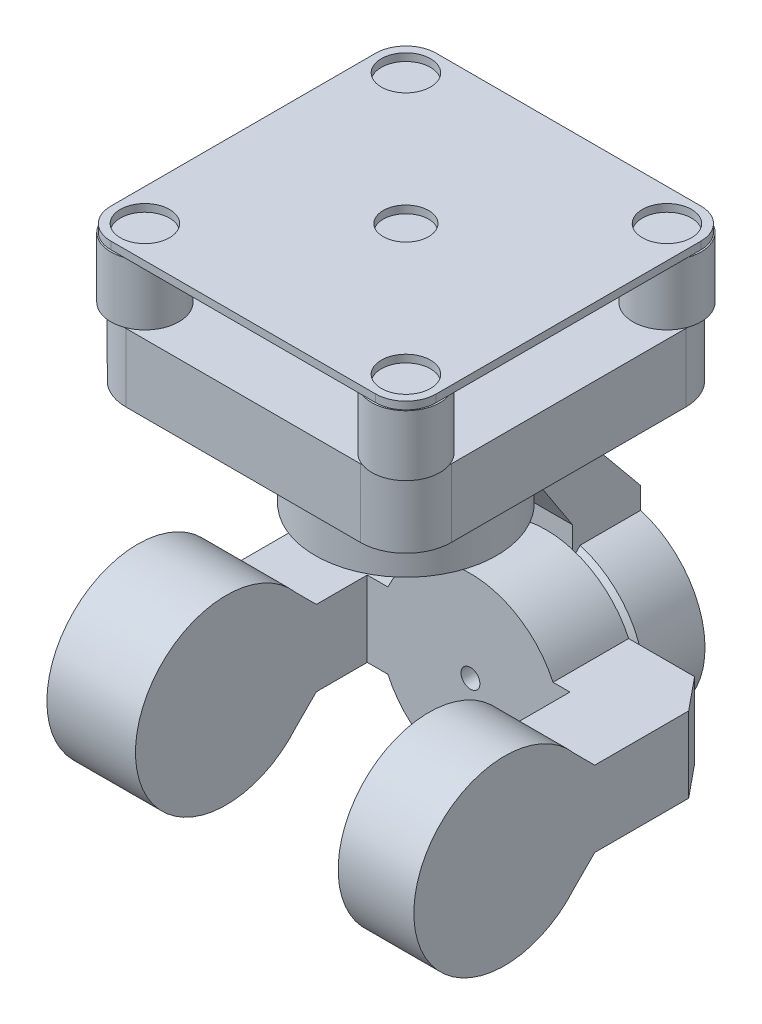
from build123d import *

# Parameters (mm, degrees)
SKETCH1_R               = 3.25
BOSS_EXTRUDE1_DEPTH     = 1
SKETCH3_R               = 4.5
BOSS_EXTRUDE2_DEPTH     = 8
SKETCH4_W               = 43
SKETCH4_H               = 43
BOSS_EXTRUDE3_DEPTH     = 9
FILLET1_R               = 6
SKETCH5_R               = 12
BOSS_EXTRUDE4_DEPTH     = 14
CUT_EXTRUDE1_START      = 7
SKETCH6_R               = 12
SKETCH6_R_2             = 11
CUT_EXTRUDE1_DEPTH      = 1
BOSS_EXTRUDE5_DEPTH     = 3.5
FILLET2_R               = 4
SKETCH8_R               = 12
BOSS_EXTRUDE6_DEPTH     = 9
CHAMFER1_SIZE           = 1
BOSS_EXTRUDE7_START     = 10
SKETCH10_R              = 12
BOSS_EXTRUDE7_DEPTH     = 10
BOSS_EXTRUDE8_DEPTH     = 5
SKETCH12_R              = 12
BOSS_EXTRUDE9_DEPTH     = 48.5
CUT_EXTRUDE2_DEPTH      = 72.827221304
CUT_EXTRUDE2_DEPTH_BACK = 20
SKETCH13_W              = 26.789167307
SKETCH13_H              = 48.357994596
CHAMFER2_SIZE           = 1
CHAMFER4_SIZE           = 1
CHAMFER5_SIZE           = 1
SKETCH17_R              = 1.25
CUT_EXTRUDE4_DEPTH      = 88.387187875
CUT_EXTRUDE5_REACH      = 79.888
SKETCH18_R              = 3
SKETCH19_R              = 1.5
CUT_EXTRUDE6_DEPTH      = 53.140487552


with BuildPart() as part:
    # Sketch1 → Boss-Extrude1 (new body)
    with BuildSketch(Plane(origin=(0, 0, 0), x_dir=(1, 0, 0), z_dir=(0, 1, 0))):
        with BuildLine():
            Line((-17.5, -21.5), (17.5, -21.5))
            ThreePointArc((17.5, -21.5), (20.328427125, -20.328427125), (21.5, -17.5))
            Line((21.5, -17.5), (21.5, 17.5))
            ThreePointArc((21.5, 17.5), (20.328427125, 20.328427125), (17.5, 21.5))
            Line((17.5, 21.5), (-17.5, 21.5))
            ThreePointArc((-17.5, 21.5), (-20.328427125, 20.328427125), (-21.5, 17.5))
            Line((-21.5, 17.5), (-21.5, -17.5))
            ThreePointArc((-21.5, -17.5), (-20.328427125, -20.328427125), (-17.5, -21.5))
        make_face()
        with Locations(Location((-17.25, 17.25, 0), (0, 0, 270))):
            Circle(SKETCH1_R, mode=Mode.SUBTRACT)
        with Locations(Location((17.25, 17.25, 0), (0, 0, 270))):
            Circle(SKETCH1_R, mode=Mode.SUBTRACT)
        with Locations(Location((17.25, -17.25, 0), (0, 0, 270))):
            Circle(SKETCH1_R, mode=Mode.SUBTRACT)
        with Locations(Location((-17.25, -17.25, 0), (0, 0, 270))):
            Circle(SKETCH1_R, mode=Mode.SUBTRACT)
    extrude(amount=BOSS_EXTRUDE1_DEPTH)

    # Sketch3 → Boss-Extrude2 (add)
    with BuildSketch(Plane.XZ):
        with Locations(Location((-17.25, 17.25, 0), (0, 0, 70.811863546))):
            Circle(SKETCH3_R)
        with Locations(Location((17.25, 17.25, 0), (0, 0, 109.188136454))):
            Circle(SKETCH3_R)
        with Locations(Location((17.25, -17.25, 0), (0, 0, 19.188136454))):
            Circle(SKETCH3_R)
        with Locations(Location((-17.25, -17.25, 0), (0, 0, 160.811863546))):
            Circle(SKETCH3_R)
    extrude(amount=BOSS_EXTRUDE2_DEPTH)

    # Sketch4 → Boss-Extrude3 (add)
    with BuildSketch(Plane.XZ.offset(8)):
        Rectangle(SKETCH4_W, SKETCH4_H)
    extrude(amount=BOSS_EXTRUDE3_DEPTH)

    # Fillet1
    # the kernel refuses this fillet: 6 mm, written as the material it takes off along each edge
    with BuildSketch(Plane(origin=(-21.5, -8, 21.5), x_dir=(1, 0, 0), z_dir=(0, -1, 0)), Plane(origin=(-21.5, -8, -21.5), x_dir=(0, 0, 1), z_dir=(0, -1, 0)), Plane(origin=(21.5, -8, 21.5), x_dir=(0, 0, -1), z_dir=(0, -1, 0))) as fillet1_piece_1:
        with BuildLine():
            CenterArc((FILLET1_R, -FILLET1_R), FILLET1_R, 90, 90)
            Line((0, -FILLET1_R), (0, 0))
            Line((0, 0), (FILLET1_R, 0))
        make_face()
    extrude(amount=24, mode=Mode.SUBTRACT)
    with BuildSketch(Plane(origin=(21.5, -8, -21.5), x_dir=(0, 0, 1), z_dir=(0, -1, 0))) as fillet1_piece_2:
        with BuildLine():
            CenterArc((FILLET1_R, FILLET1_R), FILLET1_R, 180, 90)
            Line((0, FILLET1_R), (0, 0))
            Line((0, 0), (FILLET1_R, 0))
        make_face()
    extrude(amount=24, mode=Mode.SUBTRACT)

    # Sketch5 → Boss-Extrude4 (add)
    with BuildSketch(Plane.XZ.offset(17)):
        with Locations(Location((0, 0, 0), (0, 0, 270))):
            Circle(SKETCH5_R)
    extrude(amount=BOSS_EXTRUDE4_DEPTH)

    # Sketch6 → Cut-Extrude1 (cut)
    with BuildSketch(Plane.XZ.offset(17).offset(CUT_EXTRUDE1_START)):
        with Locations(Location((0, 0, 0), (0, 0, 270))):
            Circle(SKETCH6_R)
        with Locations(Location((0, 0, 0), (0, 0, 270))):
            Circle(SKETCH6_R_2, mode=Mode.SUBTRACT)
    extrude(amount=CUT_EXTRUDE1_DEPTH, mode=Mode.SUBTRACT)

    # Sketch7 → Boss-Extrude5 (add, symmetric)
    with BuildSketch(Plane(origin=(0, 0, 0), x_dir=(0, 0, -1), z_dir=(1, 0, 0))):
        Polygon((0, -25), (14.368756657, -25), (27.527515604, -41), (27.527515604, -66.788625846), (18.527515604, -66.788625846), (18.527515604, -41), (12, -31), (0, -31), align=None)
    extrude(amount=BOSS_EXTRUDE5_DEPTH, both=True)

    # Fillet2
    fillet2_edges = [part.edges().sort_by_distance(p)[0] for p in [
        (0, -31, -12),
    ]]
    fillet(fillet2_edges, radius=FILLET2_R)

    # Sketch8 → Boss-Extrude6 (add)
    with BuildSketch(Plane.XY.offset(-18.527515604)):
        with Locations((0, -55.310385562)):
            Circle(SKETCH8_R)
    extrude(amount=-BOSS_EXTRUDE6_DEPTH)

    # Chamfer1
    chamfer1_edges = [part.edges().sort_by_distance(p)[0] for p in [
        (0, -67.310385562, -18.527515604),
    ]]
    chamfer(chamfer1_edges, length=CHAMFER1_SIZE)

    # Sketch10 → Boss-Extrude7 (add)
    with BuildSketch(Plane.XY.offset(-18.527515604).offset(BOSS_EXTRUDE7_START)):
        with Locations(Location((0, -55.310385562, 0), (0, 0, 106.9577633))):
            Circle(SKETCH10_R)
    extrude(amount=-BOSS_EXTRUDE7_DEPTH)

    # Sketch11 → Boss-Extrude8 (add, symmetric)
    with BuildSketch(Plane(origin=(0, -55.310385562, 0), x_dir=(1, 0, 0), z_dir=(0, 1, 0))):
        Polygon((-13.638649199, -5.352201133), (-13.638649199, 8.527515604), (13.150518108, 8.527515604), (13.150518108, -5.352201133), (23.153950462, -5.352201133), (23.153950462, 14.212548323), (19.620962458, 18.527515604), (-23.642081553, 18.527515604), (-23.642081553, -5.352201133), align=None)
    extrude(amount=BOSS_EXTRUDE8_DEPTH, both=True)

    # Sketch12 → Boss-Extrude9 (add)
    with BuildSketch(Plane(origin=(23.153950462, 0, 0), x_dir=(0, 0, -1), z_dir=(1, 0, 0))):
        with Locations((-10.105239438, -55.310385562)):
            Circle(SKETCH12_R)
    extrude(amount=-BOSS_EXTRUDE9_DEPTH)

    # Sketch13 → Cut-Extrude2 (cut, two sides: drawn at the far end of the back side and taken through both)
    with BuildSketch(Plane.XZ.offset(60.310385562).offset(-CUT_EXTRUDE2_DEPTH_BACK)):
        with Locations((-0.244065546, 15.651481694)):
            Rectangle(SKETCH13_W, SKETCH13_H)
    extrude(amount=CUT_EXTRUDE2_DEPTH + CUT_EXTRUDE2_DEPTH_BACK, mode=Mode.SUBTRACT)

    # Chamfer2
    # the kernel refuses this chamfer: 2.030899419, 1 mm, written as the material it adds along each edge
    with BuildSketch(Plane(origin=(13.150518108, -50.310385562, -0.803472677), x_dir=(0, 0, -1), z_dir=(1, 0, 0)), Plane(origin=(-23.642081553, -50.310385562, -0.803472677), x_dir=(0, 0, -1), z_dir=(1, 0, 0))) as chamfer2_piece_1:
        with BuildLine():
            Line((CHAMFER2_SIZE, 0), (-1.730571797, 2.730571797))
            ThreePointArc((-1.730571797, 2.730571797), (-0.794397889, 1.45760387), (0, 0))
            Line((0, 0), (CHAMFER2_SIZE, 0))
        make_face()
    extrude(amount=10.003432354)

    # Chamfer4
    # the kernel refuses this chamfer: 2.030899419, 1 mm, written as the material it adds along each edge
    with BuildSketch(Plane(origin=(13.150518108, -60.310385562, -0.803472677), x_dir=(0, 0, -1), z_dir=(1, 0, 0))) as chamfer4_piece_1:
        with BuildLine():
            Line((CHAMFER4_SIZE, 0), (-1.730571797, -2.730571797))
            ThreePointArc((-1.730571797, -2.730571797), (-0.794397889, -1.45760387), (0, 0))
            Line((0, 0), (CHAMFER4_SIZE, 0))
        make_face()
    extrude(amount=10.003432354)

    # Chamfer5
    # the kernel refuses this chamfer: 2.030899419, 1 mm, written as the material it adds along each edge
    with BuildSketch(Plane(origin=(-23.642081553, -60.310385562, -0.803472677), x_dir=(0, 0, -1), z_dir=(1, 0, 0))) as chamfer5_piece_1:
        with BuildLine():
            Line((CHAMFER5_SIZE, 0), (-1.730571797, -2.730571797))
            ThreePointArc((-1.730571797, -2.730571797), (-0.794397889, -1.45760387), (0, 0))
            Line((0, 0), (CHAMFER5_SIZE, 0))
        make_face()
    extrude(amount=10.003432354)

    # Sketch17 → Cut-Extrude4 (cut, through all)
    with BuildSketch(Plane(origin=(0, 0, -27.527515604), x_dir=(-1, 0, 0), z_dir=(0, 0, -1))):
        with Locations(Location((0, -55.310385562, 0), (0, 0, 90))):
            Circle(SKETCH17_R)
    extrude(amount=-CUT_EXTRUDE4_DEPTH, mode=Mode.SUBTRACT)

    # Sketch18 → Cut-Extrude5 (cut, up to next)
    with BuildSketch(Plane(origin=(0, 1, 0), x_dir=(1, 0, 0), z_dir=(0, 1, 0)), mode=Mode.PRIVATE) as cut_extrude5_sk1:
        with Locations(Location((0, 0, 0), (0, 0, 270))):
            Circle(SKETCH18_R)
    cut_extrude5_tool1 = extrude(cut_extrude5_sk1.sketch, amount=-CUT_EXTRUDE5_REACH, mode=Mode.PRIVATE) & part.part
    add(cut_extrude5_tool1.solids().sort_by_distance((0, 1, 0))[0], mode=Mode.SUBTRACT)

    # Sketch19 → Cut-Extrude6 (cut, through all)
    with BuildSketch(Plane.XZ.offset(31)):
        with Locations(Location((0, 0, 0), (0, 0, 270))):
            Circle(SKETCH19_R)
    extrude(amount=-CUT_EXTRUDE6_DEPTH, mode=Mode.SUBTRACT)


solid = part.part
